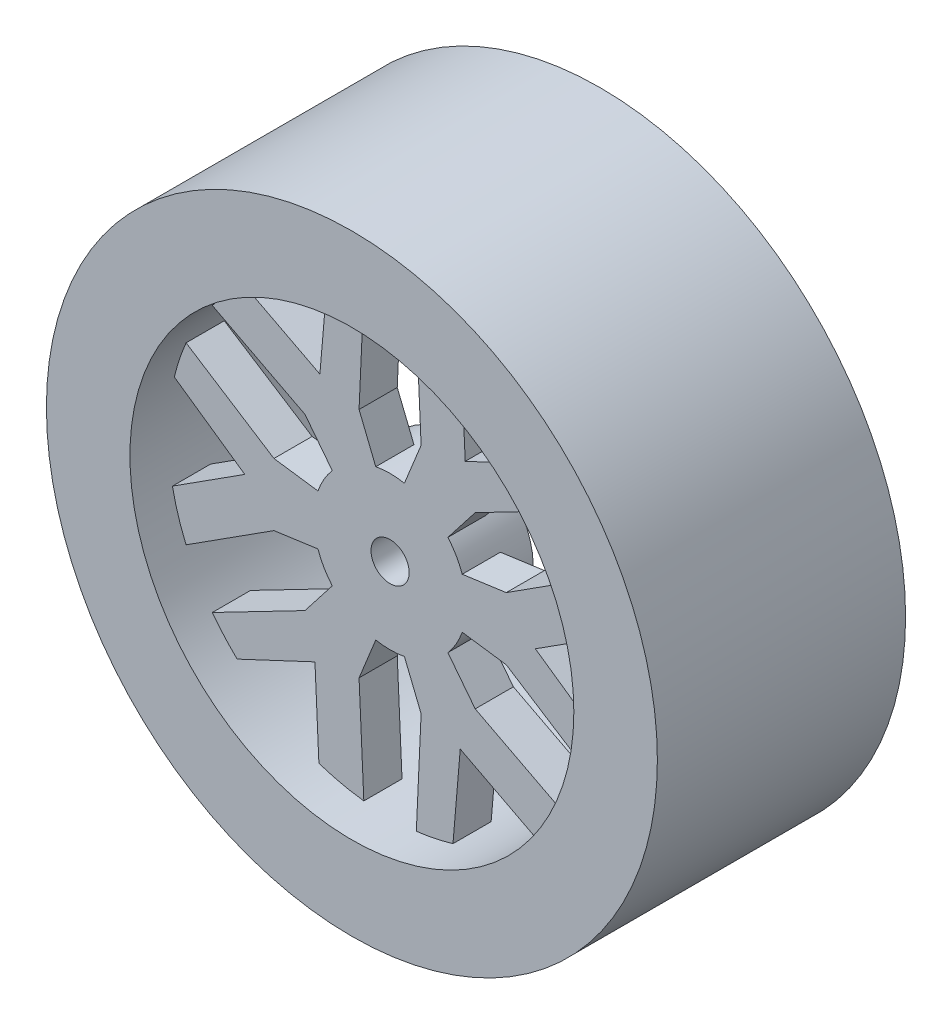
from build123d import *
from build123d.topology import SkipClean

# Parameters (mm, degrees)
ESQUISSE1_R                  = 32
BOSS_EXTRU_1_DEPTH           = 26
ESQUISSE3_R                  = 23.25
ENL_V_MAT_EXTRU_2_DEPTH      = 4
ENL_V_START                  = -18
ESQUISSE4_R                  = 23.25
ENL_V_MAT_EXTRU_3_DEPTH      = 18
ESQUISSE6_R                  = 8
BOSS_EXTRU_5_DEPTH           = 3
ESQUISSE2_R                  = 2
ENL_V_MAT_EXTRU_4_DEPTH      = 53.191953403
ENL_V_MAT_EXTRU_5_DEPTH      = 3
ENL_V_MAT_EXTRU_8_DEPTH      = 51.318982502
R_P_TITION_CIRCULAIRE1_COUNT = 6
ENL_V_MAT_EXTRU_9_DEPTH      = 51.318982502
R_P_TITION_CIRCULAIRE2_COUNT = 6


with BuildPart() as part:
    # Esquisse1 → Boss.-Extru.1 (new body)
    with BuildSketch(Plane.XY):
        with Locations(Location((0, 0, 0), (0, 0, 180))):
            Circle(ESQUISSE1_R)
    extrude(amount=BOSS_EXTRU_1_DEPTH)

    # Esquisse3 → Enlèv. mat.-Extru.2 (cut)
    with BuildSketch(Plane.XY.offset(26)):
        Circle(ESQUISSE3_R)
    extrude(amount=-ENL_V_MAT_EXTRU_2_DEPTH, mode=Mode.SUBTRACT)

    # Esquisse4 → Enlèv. mat.-Extru.3 (cut)
    with BuildSketch(Plane(origin=(0, 0, 0), x_dir=(-1, 0, 0), z_dir=(0, 0, -1)).offset(ENL_V_START)):
        with Locations(Location((0, 0, 0), (0, 0, 180))):
            Circle(ESQUISSE4_R)
    extrude(amount=ENL_V_MAT_EXTRU_3_DEPTH, mode=Mode.SUBTRACT)

    # Esquisse6 → Boss.-Extru.5 (add)
    with BuildSketch(Plane(origin=(0, 0, 18), x_dir=(-1, 0, 0), z_dir=(0, 0, -1))):
        Circle(ESQUISSE6_R)
    extrude(amount=BOSS_EXTRU_5_DEPTH)

    # Esquisse2 → Enlèv. mat.-Extru.4 (cut, through all)
    with BuildSketch(Plane.XY.offset(26)):
        Circle(ESQUISSE2_R)
    extrude(amount=-ENL_V_MAT_EXTRU_4_DEPTH, mode=Mode.SUBTRACT)

    # Esquisse7 → Enlèv. mat.-Extru.5 (cut)
    with BuildSketch(Plane(origin=(0, 0, 15), x_dir=(-1, 0, 0), z_dir=(0, 0, -1))):
        Polygon((-3.464101615, 6), (3.464101615, 6), (6.92820323, 0), (3.464101615, -6), (-3.464101615, -6), (-6.92820323, 0), align=None)
    extrude(amount=-ENL_V_MAT_EXTRU_5_DEPTH, mode=Mode.SUBTRACT)

    # Esquisse8 → Enlèv. mat.-Extru.8 (cut, through all)
    with BuildSketch(Plane.XY.offset(22)):
        with BuildLine():
            Line((-3.25, 12.171773317), (-1.5, 7.858116823))
            ThreePointArc((-1.5, 7.858116823), (0, 8), (1.5, 7.858116823))
            Line((1.5, 7.858116823), (3.25, 12.171773317))
            Line((3.25, 12.171773317), (2.75, 23.086792761))
            ThreePointArc((2.75, 23.086792761), (0, 23.25), (-2.75, 23.086792761))
            Line((-2.75, 23.086792761), (-3.25, 12.171773317))
        make_face()
    enl_v_mat_extru_8 = extrude(amount=-ENL_V_MAT_EXTRU_8_DEPTH, mode=Mode.SUBTRACT)

    # Répétition circulaire1: Enlèv. mat.-Extru.8 ×6 about axis
    with SkipClean():  # the faces are left unmerged after this step: merging them gives an invalid solid
        r_p_tition_circulaire1_axis = Axis((0, 0, 0), (0, 0, 1))
        for i in range(1, R_P_TITION_CIRCULAIRE1_COUNT):
            add(enl_v_mat_extru_8.rotate(r_p_tition_circulaire1_axis, i * 360 / R_P_TITION_CIRCULAIRE1_COUNT), mode=Mode.SUBTRACT)
    add(part.part.scale(1), mode=Mode.REPLACE)  # the faces are merged on a copy

    # Esquisse9 → Enlèv. mat.-Extru.9 (cut, through all)
    with BuildSketch(Plane.XY.offset(22)):
        with BuildLine():
            Line((7.868982797, 13.031089676), (7.457138731, 22.021661653))
            ThreePointArc((7.457138731, 22.021661653), (12.01849939, 19.902717714), (16.017447426, 16.852414603))
            Line((16.017447426, 16.852414603), (7.868982797, 13.031089676))
        make_face()
    enl_v_mat_extru_9 = extrude(amount=-ENL_V_MAT_EXTRU_9_DEPTH, mode=Mode.SUBTRACT)

    # Répétition circulaire2: Enlèv. mat.-Extru.9 ×6 about axis
    r_p_tition_circulaire2_axis = Axis((0, 0, 0), (0, 0, 1))
    for i in range(1, R_P_TITION_CIRCULAIRE2_COUNT):
        add(enl_v_mat_extru_9.rotate(r_p_tition_circulaire2_axis, i * 360 / R_P_TITION_CIRCULAIRE2_COUNT), mode=Mode.SUBTRACT)


solid = part.part
